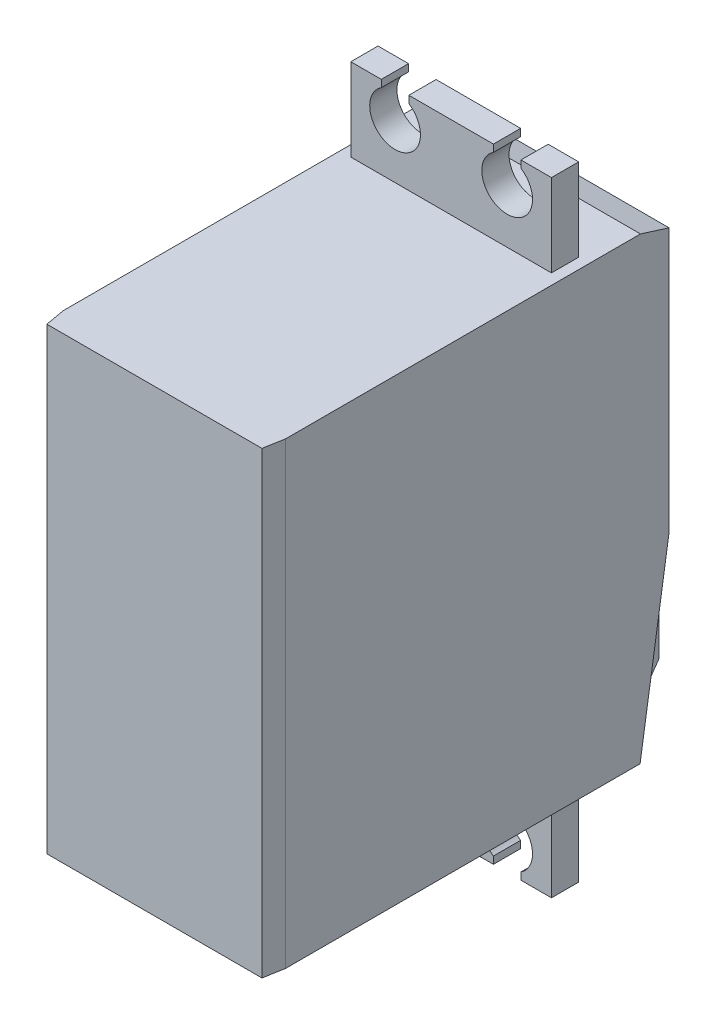
from build123d import *

# Parameters (mm, degrees)
SKETCH1_W          = 19.685
SKETCH1_H          = 40.64
EXTRUDE1_DEPTH     = 35.7632
CHAMFER1_SIZE      = 1.778
CHAMFER1_SIZE2     = 0.313509372
CHAMFER2_SIZE      = 1.778
CHAMFER2_SIZE2     = 0.313509372
CHAMFER3_SIZE      = 16.51
CHAMFER3_SIZE2     = 2.570638016
EXTRUDE2_REACH     = 44.294
SKETCH2_W          = 17.907
SKETCH2_H          = 14.732
CHAMFER4_SIZE      = 3.302
CHAMFER4_SIZE_2    = 2.312085291
SKETCH3_R          = 7.1755
EXTRUDE3_DEPTH     = 1.6256
CHAMFER5_SIZE      = 2.54
CHAMFER5_SIZE2     = 0.800858924
CHAMFER6_SIZE2     = 2.0955
CHAMFER6_SIZE      = 1.6256
SKETCH4_R          = 2.9591
CUT_EXTRUDE1_DEPTH = 10
SKETCH5_W          = 17.78
SKETCH5_H          = 2.413
EXTRUDE4_DEPTH     = 7.3152
CUT_EXTRUDE2_REACH = 43.041
SKETCH8_W          = 1.905
SKETCH8_H          = 3.81
EXTRUDE5_DEPTH     = 0.8636


# Some blends are built 0.0001 mm under size
with BuildPart() as part:
    # Sketch1 → Extrude1 (new body)
    with BuildSketch(Plane.XY):
        Rectangle(SKETCH1_W, SKETCH1_H)
    extrude(amount=EXTRUDE1_DEPTH)

    # Chamfer1
    chamfer1_edges = [part.edges().sort_by_distance(p)[0] for p in [
        (9.8425, 0, 35.7632),
    ]]
    chamfer1_side = [part.faces().sort_by_distance(p)[0] for p in [
        (9.8425, 0, 17.8816),
    ]]
    chamfer(chamfer1_edges, length=CHAMFER1_SIZE, length2=CHAMFER1_SIZE2, reference=chamfer1_side[0])

    # Chamfer2
    chamfer2_edges = [part.edges().sort_by_distance(p)[0] for p in [
        (-9.8425, 0, 35.7632),
    ]]
    chamfer2_side = [part.faces().sort_by_distance(p)[0] for p in [
        (-9.8425, 0, 17.8816),
    ]]
    chamfer(chamfer2_edges, length=CHAMFER2_SIZE, length2=CHAMFER2_SIZE2, reference=chamfer2_side[0])

    # Chamfer3
    chamfer3_edges = [part.edges().sort_by_distance(p)[0] for p in [
        (0, -20.32, 0),
    ]]
    chamfer3_side = [part.faces().sort_by_distance(p)[0] for p in [
        (0, 0, 0),
    ]]
    chamfer(chamfer3_edges, length=CHAMFER3_SIZE, length2=CHAMFER3_SIZE2, reference=chamfer3_side[0])

    # Sketch2 → Extrude2 (add, up to next)
    with BuildSketch(Plane(origin=(0, 0, 0), x_dir=(-1, 0, 0), z_dir=(0, 0, -1)), mode=Mode.PRIVATE) as extrude2_sk1:
        with Locations((0, -9.906)):
            Rectangle(SKETCH2_W, SKETCH2_H)
    extrude2_tool1 = extrude(extrude2_sk1.sketch, amount=-EXTRUDE2_REACH, mode=Mode.PRIVATE) - part.part
    add(extrude2_tool1.solids().sort_by_distance((0, -9.906, 0))[0])

    # Chamfer4
    # the kernel refuses this chamfer: 3.302, 2.312085291 mm, written as the material it takes off along each edge
    with BuildSketch(Plane(origin=(-17.481087464, -17.272, 0), x_dir=(0, 0.99975333476413, -0.022209674198457065), z_dir=(1, 0, 0))) as chamfer4_piece_1_section:
        Polygon((CHAMFER4_SIZE * 0.999753334764, CHAMFER4_SIZE * 0.0222096741985), (-CHAMFER4_SIZE_2 * 0.0222096742001, CHAMFER4_SIZE_2 * 0.999753334837), (0, 0), align=None)
    chamfer4_piece_1 = extrude(amount=34.962174929, mode=Mode.PRIVATE)
    chamfer4_piece_1 = split(chamfer4_piece_1, bisect_by=Plane(origin=(0, -15.96847592, 1.893097542), z_dir=(0, -0.15384816987279037, -0.9880944998464434)), keep=Keep.TOP, mode=Mode.PRIVATE)
    add(chamfer4_piece_1, mode=Mode.SUBTRACT)

    # Sketch3 → Extrude3 (add)
    with BuildSketch(Plane(origin=(0, 0, 0), x_dir=(-1, 0, 0), z_dir=(0, 0, -1))):
        with Locations(Location((0, 9.4615, 0), (0, 0, 180))):
            Circle(SKETCH3_R)
    extrude(amount=EXTRUDE3_DEPTH)

    # Chamfer5
    chamfer5_edges = [part.edges().sort_by_distance(p)[0] for p in [
        (0, 20.32, 0),
    ]]
    chamfer5_side = [part.faces().sort_by_distance(p)[0] for p in [
        (0, 20.32, 17.867899933),
    ]]
    chamfer(chamfer5_edges, length=CHAMFER5_SIZE, length2=CHAMFER5_SIZE2, reference=chamfer5_side[0])

    # Chamfer6
    chamfer6_edges = [part.edges().sort_by_distance(p)[0] for p in [
        (-7.1755, 9.4615, -1.6256),
    ]]
    chamfer6_side = [part.faces().sort_by_distance(p)[0] for p in [
        (-7.1755, 9.4615, -1.593088),
    ]]
    chamfer(chamfer6_edges, length=CHAMFER6_SIZE - 0.0001, length2=CHAMFER6_SIZE2 - 0.0001, reference=chamfer6_side[0])  # a hair under: the kernel refuses the full size

    # Sketch4 → Cut-Extrude1 (cut)
    with BuildSketch(Plane(origin=(0, 0, -1.6256), x_dir=(-1, 0, 0), z_dir=(0, 0, -1))):
        with Locations((0, 9.4615)):
            Circle(SKETCH4_R)
    extrude(amount=-CUT_EXTRUDE1_DEPTH, mode=Mode.SUBTRACT)

    # Sketch5 → Extrude4 (add)
    with BuildSketch(Plane(origin=(0, 20.32, 0), x_dir=(1, 0, 0), z_dir=(0, 1, 0))):
        with Locations((0, -8.2677)):
            Rectangle(SKETCH5_W, SKETCH5_H)
    extrude4 = extrude(amount=EXTRUDE4_DEPTH)

    # Sketch6 → Cut-Extrude2 (cut, up to next)
    with BuildSketch(Plane(origin=(0, 0, 7.0612), x_dir=(-1, 0, 0), z_dir=(0, 0, -1)), mode=Mode.PRIVATE) as cut_extrude2_sk1:
        with BuildLine():
            Line((-6.1849, 27.6352), (-3.7465, 27.6352))
            Line((-3.7465, 27.6352), (-3.7465, 26.996445941))
            ThreePointArc((-3.7465, 26.996445941), (-4.9657, 22.86), (-6.1849, 26.996445941))
            Line((-6.1849, 26.996445941), (-6.1849, 27.6352))
        make_face()
    cut_extrude2_tool1 = extrude(cut_extrude2_sk1.sketch, amount=-CUT_EXTRUDE2_REACH, mode=Mode.PRIVATE) & part.part
    # Sketch6 → Cut-Extrude2 (cut, up to next)
    with BuildSketch(Plane(origin=(0, 0, 7.0612), x_dir=(-1, 0, 0), z_dir=(0, 0, -1)), mode=Mode.PRIVATE) as cut_extrude2_sk2:
        with BuildLine():
            Line((3.7465, 27.6352), (6.1849, 27.6352))
            Line((6.1849, 27.6352), (6.1849, 26.996445941))
            ThreePointArc((6.1849, 26.996445941), (4.9657, 22.86), (3.7465, 26.996445941))
            Line((3.7465, 26.996445941), (3.7465, 27.6352))
        make_face()
    cut_extrude2_tool2 = extrude(cut_extrude2_sk2.sketch, amount=-CUT_EXTRUDE2_REACH, mode=Mode.PRIVATE) & part.part
    cut_extrude2_1 = cut_extrude2_tool1.solids().sort_by_distance((4.9657, 25.240383, 7.0612))[0]
    add(cut_extrude2_1, mode=Mode.SUBTRACT)
    cut_extrude2_2 = cut_extrude2_tool2.solids().sort_by_distance((-4.9657, 25.240383, 7.0612))[0]
    add(cut_extrude2_2, mode=Mode.SUBTRACT)
    cut_extrude2 = cut_extrude2_1 + cut_extrude2_2  # Cut-Extrude2 as one shape, for the pattern or mirror that repeats it

    # Sketch8 → Extrude5 (add)
    with BuildSketch(Plane(origin=(0, 0, 7.0612), x_dir=(-1, 0, 0), z_dir=(0, 0, -1))):
        with Locations((0, 22.225)):
            Rectangle(SKETCH8_W, SKETCH8_H)
    extrude5 = extrude(amount=EXTRUDE5_DEPTH)

    # Mirror1: Extrude4, Cut-Extrude2, Extrude5 across plane
    add(extrude4.mirror(Plane.ZX))
    add(cut_extrude2.mirror(Plane.ZX), mode=Mode.SUBTRACT)
    add(extrude5.mirror(Plane.ZX))


solid = part.part
